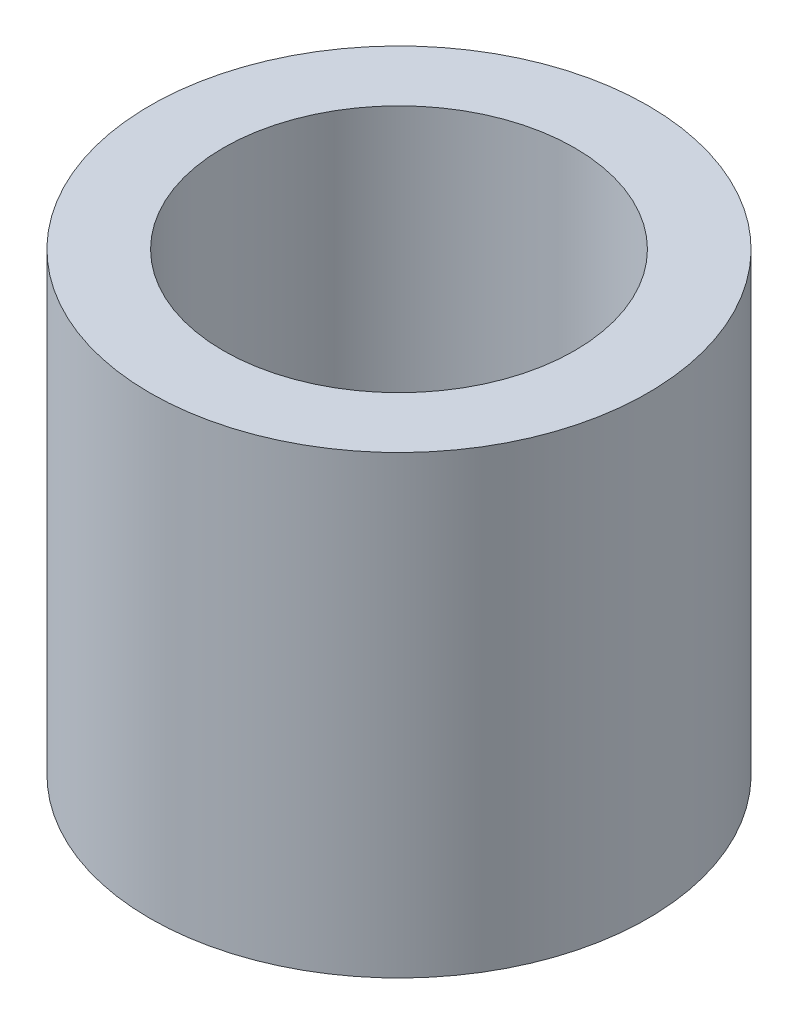
from build123d import *

# Parameters (mm, degrees)
SKETCH1_R           = 32.5
BOSS_EXTRUDE1_DEPTH = 59.40694548
SKETCH2_R           = 22.932959854
CUT_EXTRUDE1_DEPTH  = 76.11115211


with BuildPart() as part:
    # Sketch1 → Boss-Extrude1 (new body)
    with BuildSketch(Plane(origin=(0, 0, 0), x_dir=(1, 0, 0), z_dir=(0, 1, 0))):
        Circle(SKETCH1_R)
    extrude(amount=BOSS_EXTRUDE1_DEPTH)

    # Sketch2 → Cut-Extrude1 (cut, through all)
    with BuildSketch(Plane(origin=(0, 0, 0), x_dir=(1, 0, 0), z_dir=(0, 1, 0))):
        Circle(SKETCH2_R)
    extrude(amount=CUT_EXTRUDE1_DEPTH, mode=Mode.SUBTRACT)


solid = part.part
